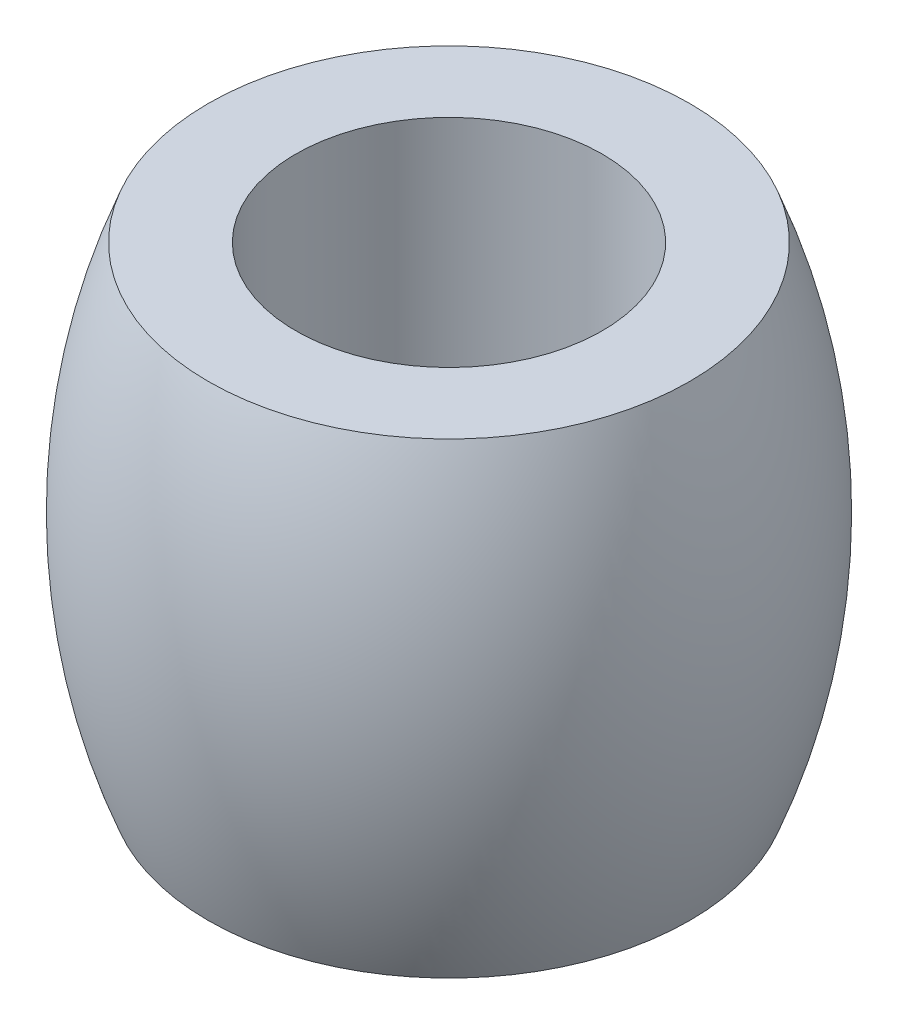
from build123d import *


with BuildPart() as part:
    # Sketch1 → Revolve1 (revolve)
    with BuildSketch(Plane.XY):
        with BuildLine():
            Line((-5.25, 16), (-5.25, 0))
            Line((-5.25, 0), (-8.25, 0))
            ThreePointArc((-8.25, 0), (-9.756098468, 8), (-8.25, 16))
            Line((-8.25, 16), (-5.25, 16))
        make_face()
    revolve(axis=Axis((0, 0, 0), (0, 1, 0)))


solid = part.part
